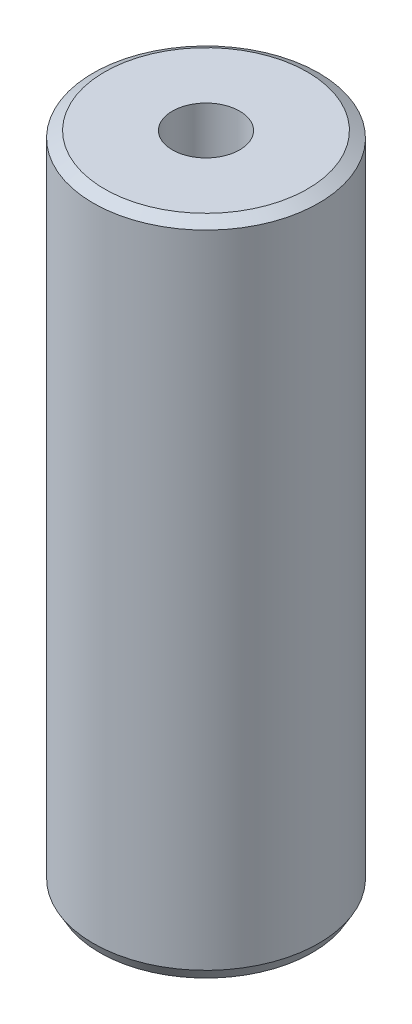
from build123d import *
from OCP.BRepFilletAPI import BRepFilletAPI_MakeChamfer

# Parameters (mm, degrees)
SKETCH1_R           = 32.5
BOSS_EXTRUDE1_DEPTH = 189.898432151
SKETCH2_R           = 9.699321873
CUT_EXTRUDE1_DEPTH  = 196.381459032
CHAMFER1_SIZE       = 1.885342049
CHAMFER1_SIZE2      = 3.265508219


with BuildPart() as part:
    # Sketch1 → Boss-Extrude1 (new body)
    with BuildSketch(Plane(origin=(0, 0, 0), x_dir=(1, 0, 0), z_dir=(0, 1, 0))):
        Circle(SKETCH1_R)
    extrude(amount=BOSS_EXTRUDE1_DEPTH)

    # Sketch2 → Cut-Extrude1 (cut, through all)
    with BuildSketch(Plane(origin=(0, 0, 0), x_dir=(1, 0, 0), z_dir=(0, 1, 0))):
        Circle(SKETCH2_R)
    extrude(amount=CUT_EXTRUDE1_DEPTH, mode=Mode.SUBTRACT)

    # Chamfer1: one chamfer whose edges measure the first distance from different faces: ONE call of the kernel's chamfer builder (chamfer() names one face for all edges)
    chamfer1_edges_1 = [part.edges().sort_by_distance(p)[0] for p in [
        (-32.5, 189.898432151, 0),
    ]]
    chamfer1_side_1 = [part.faces().sort_by_distance(p)[0] for p in [
        (-32.5, 94.949216075, 0),
    ]]
    chamfer1_edges_2 = [part.edges().sort_by_distance(p)[0] for p in [
        (-32.5, 0, 0),
    ]]
    chamfer1_side_2 = [part.faces().sort_by_distance(p)[0] for p in [
        (-31.580761184, 0, 0),
    ]]
    chamfer1 = BRepFilletAPI_MakeChamfer(part.part.solid().wrapped)
    for e in chamfer1_edges_1:
        chamfer1.Add(CHAMFER1_SIZE, CHAMFER1_SIZE2, e.wrapped, chamfer1_side_1[0].wrapped)  # the first distance lies on this face
    for e in chamfer1_edges_2:
        chamfer1.Add(CHAMFER1_SIZE, CHAMFER1_SIZE2, e.wrapped, chamfer1_side_2[0].wrapped)  # the first distance lies on this face
    add(Compound.cast(chamfer1.Shape()), mode=Mode.REPLACE)


solid = part.part
